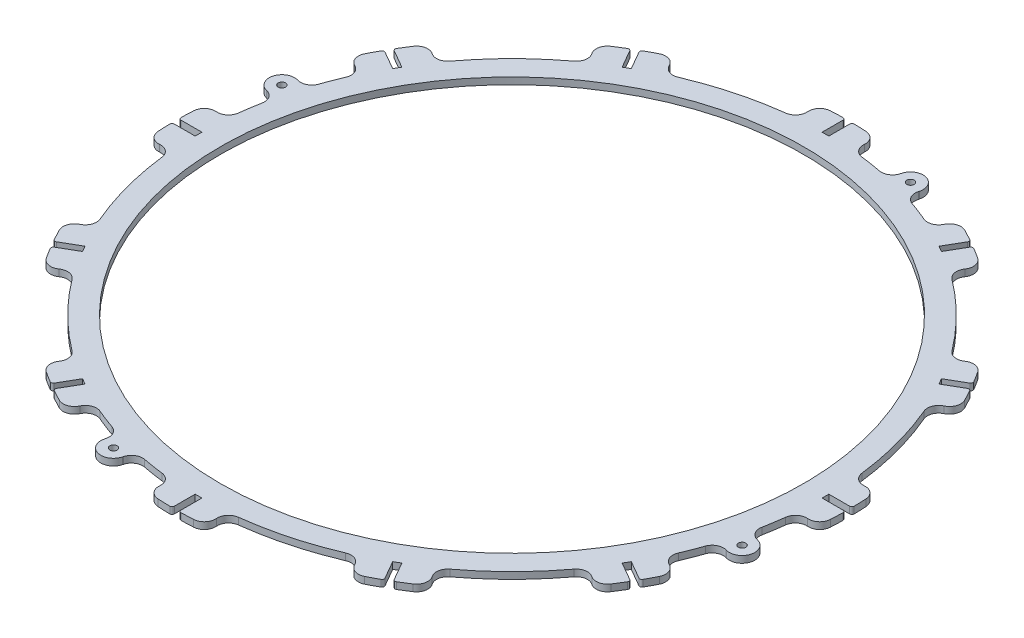
from build123d import *

# Parameters (mm, degrees)
SKETCH1_R                = 150
SKETCH1_R_2              = 130
BOSS_EXTRUDE1_DEPTH      = 3
SKETCH2_W                = 3
SKETCH2_H                = 12.624935537
CUT_EXTRUDE1_DEPTH       = 3
FILLET1_R                = 1
CIRPATTERN1_COUNT        = 12
FILLET1_OF_CIRPATTERN1_R = 1
CUT_EXTRUDE2_START       = -10
CUT_EXTRUDE2_DEPTH       = 10
FILLET2_R                = 5
CIRPATTERN2_COUNT        = 12
FILLET2_OF_CIRPATTERN2_R = 5
BOSS_EXTRUDE3_START      = -3
SKETCH5_R                = 1.65
BOSS_EXTRUDE3_DEPTH      = 3


with BuildPart() as part:
    # Sketch1 → Boss-Extrude1 (new body)
    with BuildSketch(Plane(origin=(0, 0, 0), x_dir=(1, 0, 0), z_dir=(0, 1, 0))):
        with Locations(Location((0, 0, 0), (0, 0, 270))):
            Circle(SKETCH1_R)
        with Locations(Location((0, 0, 0), (0, 0, 270))):
            Circle(SKETCH1_R_2, mode=Mode.SUBTRACT)
    extrude(amount=BOSS_EXTRUDE1_DEPTH)

    # Sketch2 → Cut-Extrude1 (cut)
    with BuildSketch(Plane(origin=(0, 3, 0), x_dir=(1, 0, 0), z_dir=(0, 1, 0))):
        with Locations((0, 146.012467769)):
            Rectangle(SKETCH2_W, SKETCH2_H)
    cut_extrude1 = extrude(amount=-CUT_EXTRUDE1_DEPTH, mode=Mode.SUBTRACT)

    # Fillet1
    fillet1_edges = [part.edges().sort_by_distance(p)[0] for p in [
        (-1.5, 1.5, -149.992499812),
        (1.5, 1.5, -149.992499812),
    ]]
    fillet(fillet1_edges, radius=FILLET1_R)

    # CirPattern1: Cut-Extrude1 ×12 about axis
    cirpattern1_axis = Axis((0, 0, 0), (0, 1, 0))
    for i in range(1, CIRPATTERN1_COUNT):
        add(cut_extrude1.rotate(cirpattern1_axis, i * 360 / CIRPATTERN1_COUNT), mode=Mode.SUBTRACT)

    # Fillet1 of CirPattern1
    fillet1_of_cirpattern1_edges = [part.edges().sort_by_distance(p)[0] for p in [
        (-76.295288012, 1.5, -129.147315215),
        (-73.697211801, 1.5, -130.647315215),
        (-130.647315215, 1.5, -73.697211801),
        (-129.147315215, 1.5, -76.295288012),
        (-149.992499812, 1.5, 1.5),
        (-149.992499812, 1.5, -1.5),
        (-129.147315215, 1.5, 76.295288012),
        (-130.647315215, 1.5, 73.697211801),
        (-73.697211801, 1.5, 130.647315215),
        (-76.295288012, 1.5, 129.147315215),
        (1.5, 1.5, 149.992499812),
        (-1.5, 1.5, 149.992499812),
        (76.295288012, 1.5, 129.147315215),
        (73.697211801, 1.5, 130.647315215),
        (130.647315215, 1.5, 73.697211801),
        (129.147315215, 1.5, 76.295288012),
        (149.992499812, 1.5, -1.5),
        (149.992499812, 1.5, 1.5),
        (129.147315215, 1.5, -76.295288012),
        (130.647315215, 1.5, -73.697211801),
        (73.697211801, 1.5, -130.647315215),
        (76.295288012, 1.5, -129.147315215),
    ]]
    fillet(fillet1_of_cirpattern1_edges, radius=FILLET1_OF_CIRPATTERN1_R)

    # Sketch3 → Cut-Extrude2 (cut)
    with BuildSketch(Plane(origin=(0, 3, 0), x_dir=(1, 0, 0), z_dir=(0, 1, 0)).offset(CUT_EXTRUDE2_START)):
        with BuildLine():
            Line((12.201803985, 139.467257733), (13.073361412, 149.429204714))
            ThreePointArc((13.073361412, 149.429204714), (38.822856765, 144.888873943), (63.392739261, 135.946168055))
            Line((63.392739261, 135.946168055), (59.166556644, 126.883090185))
            ThreePointArc((59.166556644, 126.883090185), (36.234666314, 135.22961568), (12.201803985, 139.467257733))
        make_face()
    cut_extrude2 = extrude(amount=CUT_EXTRUDE2_DEPTH, mode=Mode.SUBTRACT)

    # Fillet2
    fillet2_edges = [part.edges().sort_by_distance(p)[0] for p in [
        (63.392739261, 1.5, -135.946168055),
        (13.073361412, 1.5, -149.429204714),
        (12.201803985, 1.5, -139.467257733),
        (59.166556644, 1.5, -126.883090185),
    ]]
    fillet(fillet2_edges, radius=FILLET2_R - 0.0001)  # a hair under: the kernel refuses the full size

    # CirPattern2: Cut-Extrude2 ×12 about axis
    cirpattern2_axis = Axis((0, 0, 0), (0, 1, 0))
    for i in range(1, CIRPATTERN2_COUNT):
        add(cut_extrude2.rotate(cirpattern2_axis, i * 360 / CIRPATTERN2_COUNT), mode=Mode.SUBTRACT)

    # Fillet2 of CirPattern2
    fillet2_of_cirpattern2_edges = [part.edges().sort_by_distance(p)[0] for p in [
        (-13.073361412, 1.5, -149.429204714),
        (-63.392739261, 1.5, -135.946168055),
        (-59.166556644, 1.5, -126.883090185),
        (-12.201803985, 1.5, -139.467257733),
        (-86.036465453, 1.5, -122.872806643),
        (-122.872806643, 1.5, -86.036465453),
        (-114.6812862, 1.5, -80.300701089),
        (-80.300701089, 1.5, -114.6812862),
        (-135.946168055, 1.5, -63.392739261),
        (-149.429204714, 1.5, -13.073361412),
        (-139.467257733, 1.5, -12.201803985),
        (-126.883090185, 1.5, -59.166556644),
        (-149.429204714, 1.5, 13.073361412),
        (-135.946168055, 1.5, 63.392739261),
        (-126.883090185, 1.5, 59.166556644),
        (-139.467257733, 1.5, 12.201803985),
        (-122.872806643, 1.5, 86.036465453),
        (-86.036465453, 1.5, 122.872806643),
        (-80.300701089, 1.5, 114.6812862),
        (-114.6812862, 1.5, 80.300701089),
        (-63.392739261, 1.5, 135.946168055),
        (-13.073361412, 1.5, 149.429204714),
        (-12.201803985, 1.5, 139.467257733),
        (-59.166556644, 1.5, 126.883090185),
        (13.073361412, 1.5, 149.429204714),
        (63.392739261, 1.5, 135.946168055),
        (59.166556644, 1.5, 126.883090185),
        (12.201803985, 1.5, 139.467257733),
        (86.036465453, 1.5, 122.872806643),
        (122.872806643, 1.5, 86.036465453),
        (114.6812862, 1.5, 80.300701089),
        (80.300701089, 1.5, 114.6812862),
        (135.946168055, 1.5, 63.392739261),
        (149.429204714, 1.5, 13.073361412),
        (139.467257733, 1.5, 12.201803985),
        (126.883090185, 1.5, 59.166556644),
        (149.429204714, 1.5, -13.073361412),
        (135.946168055, 1.5, -63.392739261),
        (126.883090185, 1.5, -59.166556644),
        (139.467257733, 1.5, -12.201803985),
        (122.872806643, 1.5, -86.036465453),
        (86.036465453, 1.5, -122.872806643),
        (80.300701089, 1.5, -114.6812862),
        (114.6812862, 1.5, -80.300701089),
    ]]
    fillet(fillet2_of_cirpattern2_edges, radius=FILLET2_OF_CIRPATTERN2_R - 0.0001)  # a hair under: the kernel refuses the full size

    # Sketch5 → Boss-Extrude3 (add)
    # profile 1 of 4: a face of its own
    with BuildSketch(Plane(origin=(0, 3, 0), x_dir=(1, 0, 0), z_dir=(0, 1, 0)).offset(BOSS_EXTRUDE3_START)):
        with BuildLine():
            Line((42.986242458, 138.596917207), (42.884878315, 138.218621075))
            ThreePointArc((42.884878315, 138.218621075), (43.295432902, 134.585342196), (46.069179604, 132.202990475))
            ThreePointArc((46.069179604, 132.202990475), (43.871928588, 132.948312821), (41.662627526, 133.657119031))
            Line((41.662627526, 133.657119031), (40.824435383, 130.528943366))
            ThreePointArc((40.824435383, 130.528943366), (33.90462686, 126.533790052), (29.909473546, 133.453598576))
            Line((29.909473546, 133.453598576), (30.747665689, 136.58177424))
            ThreePointArc((30.747665689, 136.58177424), (28.47995174, 137.072580587), (26.204415369, 137.52573801))
            ThreePointArc((26.204415369, 137.52573801), (29.797726337, 138.202041769), (31.969916478, 141.143276285))
            Line((31.969916478, 141.143276285), (32.071280621, 141.521572417))
            ThreePointArc((32.071280621, 141.521572417), (38.991089145, 145.51672573), (42.986242458, 138.596917207))
        make_face()
        with Locations(Location((37.52876154, 140.059244812, 0), (0, 0, 270))):
            Circle(SKETCH5_R, mode=Mode.SUBTRACT)
    # profile 2 of 4: a face of its own
    with BuildSketch(Plane(origin=(0, 3, 0), x_dir=(1, 0, 0), z_dir=(0, 1, 0)).offset(BOSS_EXTRUDE3_START)):
        with BuildLine():
            Line((138.596917207, -42.986242458), (138.218621075, -42.884878315))
            ThreePointArc((138.218621075, -42.884878315), (134.585342196, -43.295432902), (132.202990475, -46.069179604))
            ThreePointArc((132.202990475, -46.069179604), (132.948312821, -43.871928588), (133.657119031, -41.662627526))
            Line((133.657119031, -41.662627526), (130.528943366, -40.824435383))
            ThreePointArc((130.528943366, -40.824435383), (126.533790052, -33.90462686), (133.453598576, -29.909473546))
            Line((133.453598576, -29.909473546), (136.58177424, -30.747665689))
            ThreePointArc((136.58177424, -30.747665689), (137.072580587, -28.47995174), (137.52573801, -26.204415369))
            ThreePointArc((137.52573801, -26.204415369), (138.202041769, -29.797726337), (141.143276285, -31.969916478))
            Line((141.143276285, -31.969916478), (141.521572417, -32.071280621))
            ThreePointArc((141.521572417, -32.071280621), (145.51672573, -38.991089145), (138.596917207, -42.986242458))
        make_face()
        with Locations(Location((140.059244812, -37.52876154, 0), (0, 0, 270))):
            Circle(SKETCH5_R, mode=Mode.SUBTRACT)
    # profile 3 of 4: a face of its own
    with BuildSketch(Plane(origin=(0, 3, 0), x_dir=(1, 0, 0), z_dir=(0, 1, 0)).offset(BOSS_EXTRUDE3_START)):
        with BuildLine():
            Line((-42.986242458, -138.596917207), (-42.884878315, -138.218621075))
            ThreePointArc((-42.884878315, -138.218621075), (-43.295432902, -134.585342196), (-46.069179604, -132.202990475))
            ThreePointArc((-46.069179604, -132.202990475), (-43.871928588, -132.948312821), (-41.662627526, -133.657119031))
            Line((-41.662627526, -133.657119031), (-40.824435383, -130.528943366))
            ThreePointArc((-40.824435383, -130.528943366), (-33.90462686, -126.533790052), (-29.909473546, -133.453598576))
            Line((-29.909473546, -133.453598576), (-30.747665689, -136.58177424))
            ThreePointArc((-30.747665689, -136.58177424), (-28.47995174, -137.072580587), (-26.204415369, -137.52573801))
            ThreePointArc((-26.204415369, -137.52573801), (-29.797726337, -138.202041769), (-31.969916478, -141.143276285))
            Line((-31.969916478, -141.143276285), (-32.071280621, -141.521572417))
            ThreePointArc((-32.071280621, -141.521572417), (-38.991089145, -145.51672573), (-42.986242458, -138.596917207))
        make_face()
        with Locations(Location((-37.52876154, -140.059244812, 0), (0, 0, 270))):
            Circle(SKETCH5_R, mode=Mode.SUBTRACT)
    # profile 4 of 4: a face of its own
    with BuildSketch(Plane(origin=(0, 3, 0), x_dir=(1, 0, 0), z_dir=(0, 1, 0)).offset(BOSS_EXTRUDE3_START)):
        with BuildLine():
            Line((-138.596917207, 42.986242458), (-138.218621075, 42.884878315))
            ThreePointArc((-138.218621075, 42.884878315), (-134.585342196, 43.295432902), (-132.202990475, 46.069179604))
            ThreePointArc((-132.202990475, 46.069179604), (-132.948312821, 43.871928588), (-133.657119031, 41.662627526))
            Line((-133.657119031, 41.662627526), (-130.528943366, 40.824435383))
            ThreePointArc((-130.528943366, 40.824435383), (-126.533790052, 33.90462686), (-133.453598576, 29.909473546))
            Line((-133.453598576, 29.909473546), (-136.58177424, 30.747665689))
            ThreePointArc((-136.58177424, 30.747665689), (-137.072580587, 28.47995174), (-137.52573801, 26.204415369))
            ThreePointArc((-137.52573801, 26.204415369), (-138.202041769, 29.797726337), (-141.143276285, 31.969916478))
            Line((-141.143276285, 31.969916478), (-141.521572417, 32.071280621))
            ThreePointArc((-141.521572417, 32.071280621), (-145.51672573, 38.991089145), (-138.596917207, 42.986242458))
        make_face()
        with Locations(Location((-140.059244812, 37.52876154, 0), (0, 0, 270))):
            Circle(SKETCH5_R, mode=Mode.SUBTRACT)
    extrude(amount=BOSS_EXTRUDE3_DEPTH)


solid = part.part
